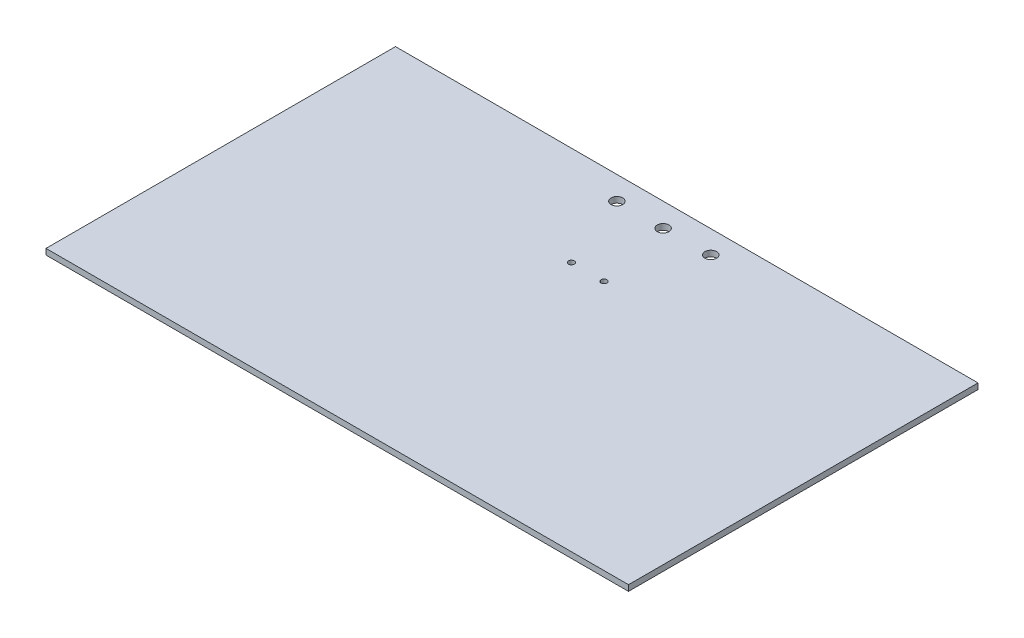
from build123d import *

# Parameters (mm, degrees)
SKETCH2_W               = 500
SKETCH2_H               = 300
BOSS_EXTRUDE1_DEPTH     = 5
CUT_EXTRUDE1_DEPTH      = 292.590466236
CUT_EXTRUDE1_DEPTH_BACK = 292.590466236
SKETCH3_R               = 5
CUT_EXTRUDE2_DEPTH      = 292.590466236
CUT_EXTRUDE2_DEPTH_BACK = 292.590466236
SKETCH4_R               = 5
SKETCH5_R               = 2.5
CUT_EXTRUDE3_DEPTH      = 292.590466236


with BuildPart() as part:
    # Sketch2 → Boss-Extrude1 (new body)
    with BuildSketch(Plane(origin=(0, 0, 0), x_dir=(1, 0, 0), z_dir=(0, 1, 0))):
        Rectangle(SKETCH2_W, SKETCH2_H)
    extrude(amount=BOSS_EXTRUDE1_DEPTH)

    # Sketch3 → Cut-Extrude1 (cut, two sides: drawn at the far end of the back side and taken through both)
    with BuildSketch(Plane.XZ.offset(-CUT_EXTRUDE1_DEPTH_BACK)):
        with Locations((-40.044249933, -130.077128907)):
            Circle(SKETCH3_R)
        with Locations((-0.071386653, -129.777985414)):
            Circle(SKETCH3_R)
    extrude(amount=CUT_EXTRUDE1_DEPTH + CUT_EXTRUDE1_DEPTH_BACK, mode=Mode.SUBTRACT)

    # Sketch4 → Cut-Extrude2 (cut, two sides: drawn at the far end of the back side and taken through both)
    with BuildSketch(Plane(origin=(0, 5, 0), x_dir=(1, 0, 0), z_dir=(0, 1, 0)).offset(-CUT_EXTRUDE2_DEPTH_BACK)):
        with Locations((40.196351758, 130.448547008)):
            Circle(SKETCH4_R)
    extrude(amount=CUT_EXTRUDE2_DEPTH + CUT_EXTRUDE2_DEPTH_BACK, mode=Mode.SUBTRACT)

    # Sketch5 → Cut-Extrude3 (cut, through all)
    with BuildSketch(Plane(origin=(0, 5, 0), x_dir=(1, 0, 0), z_dir=(0, 1, 0))):
        with Locations((14, 65)):
            Circle(SKETCH5_R)
        with Locations((-14, 65)):
            Circle(SKETCH5_R)
    extrude(amount=-CUT_EXTRUDE3_DEPTH, mode=Mode.SUBTRACT)


solid = part.part
